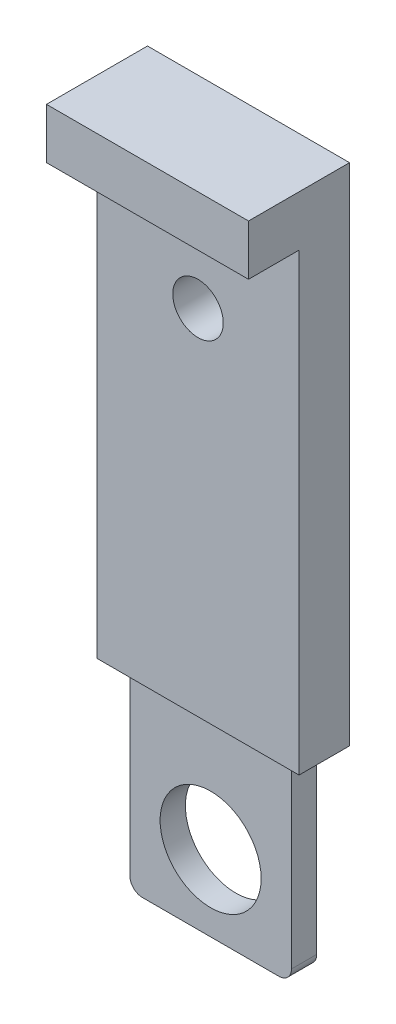
from build123d import *

# Parameters (mm, degrees)
SZKIC1_W                    = 4
SZKIC1_H                    = 1
DODANIE_WYCI_GNI_CIE1_DEPTH = 10
SZKIC2_R                    = 0.5
WYTNIJ_WYCI_GNI_CIE1_DEPTH  = 10
SZKIC3_W                    = 4
SZKIC3_H                    = 1
DODANIE_WYCI_GNI_CIE2_DEPTH = 1
SZKIC4_W                    = 3.2
SZKIC4_H                    = 0.5
DODANIE_WYCI_GNI_CIE3_DEPTH = 3.9
SZKIC5_R                    = 1
WYTNIJ_WYCI_GNI_CIE2_DEPTH  = 3.9
ZAOKR_GLENIE1_R             = 0.25


with BuildPart() as part:
    # Szkic1 → Dodanie-wyciągnięcie1 (new body)
    with BuildSketch(Plane(origin=(0, 0, 0), x_dir=(1, 0, 0), z_dir=(0, 1, 0))):
        Rectangle(SZKIC1_W, SZKIC1_H)
    extrude(amount=DODANIE_WYCI_GNI_CIE1_DEPTH)

    # Szkic2 → Wytnij-wyciągnięcie1 (cut)
    with BuildSketch(Plane(origin=(0, 0, -0.5), x_dir=(-1, 0, 0), z_dir=(0, 0, -1))):
        with Locations((0, 7)):
            Circle(SZKIC2_R)
    extrude(amount=-WYTNIJ_WYCI_GNI_CIE1_DEPTH, mode=Mode.SUBTRACT)

    # Szkic3 → Dodanie-wyciągnięcie2 (add)
    with BuildSketch(Plane.XY.offset(0.5)):
        with Locations((0, 9.5)):
            Rectangle(SZKIC3_W, SZKIC3_H)
    extrude(amount=DODANIE_WYCI_GNI_CIE2_DEPTH)

    # Szkic4 → Dodanie-wyciągnięcie3 (add)
    with BuildSketch(Plane(origin=(0, 0, 0), x_dir=(-1, 0, 0), z_dir=(0, -1, 0))):
        Rectangle(SZKIC4_W, SZKIC4_H)
    extrude(amount=DODANIE_WYCI_GNI_CIE3_DEPTH)

    # Szkic5 → Wytnij-wyciągnięcie2 (cut)
    with BuildSketch(Plane.XY.offset(0.25)):
        with Locations((0, -2.4)):
            Circle(SZKIC5_R)
    extrude(amount=-WYTNIJ_WYCI_GNI_CIE2_DEPTH, mode=Mode.SUBTRACT)

    # Zaokrąglenie1
    zaokr_glenie1_edges = [part.edges().sort_by_distance(p)[0] for p in [
        (-1.6, 0, 0),
        (0, 0, -0.25),
        (1.6, 0, 0),
        (0, 0, 0.25),
        (-1.6, -3.9, 0),
        (1.6, -3.9, 0),
    ]]
    fillet(zaokr_glenie1_edges, radius=ZAOKR_GLENIE1_R - 0.0001)  # a hair under: the kernel refuses the full size


solid = part.part
